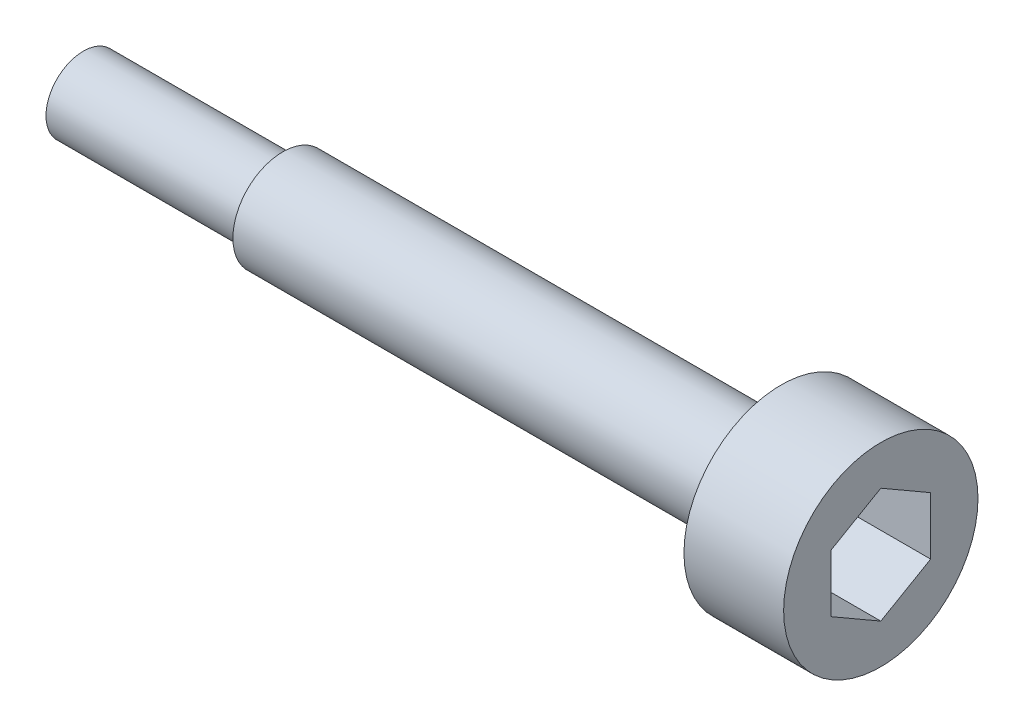
from build123d import *

# Parameters (mm, degrees)
CUT_EXTRUDE_1_DEPTH = 3


with BuildPart() as part:
    # 草图2 → 旋转1 (revolve)
    with BuildSketch(Plane.XY):
        Polygon((0, 0), (0, 1.5), (8, 1.5), (8, 2), (28, 2), (28, 3.9), (32, 3.9), (32, 0), align=None)
    revolve(axis=Axis((0, 0, 0), (1, 0, 0)))

    # 草图3 → 切除-拉伸1 (cut)
    with BuildSketch(Plane(origin=(32, 0, 0), x_dir=(0, 0, -1), z_dir=(1, 0, 0))):
        Polygon((0, 2.309401077), (-2, 1.154700538), (-2, -1.154700538), (0, -2.309401077), (2, -1.154700538), (2, 1.154700538), align=None)
    extrude(amount=-CUT_EXTRUDE_1_DEPTH, mode=Mode.SUBTRACT)


solid = part.part
